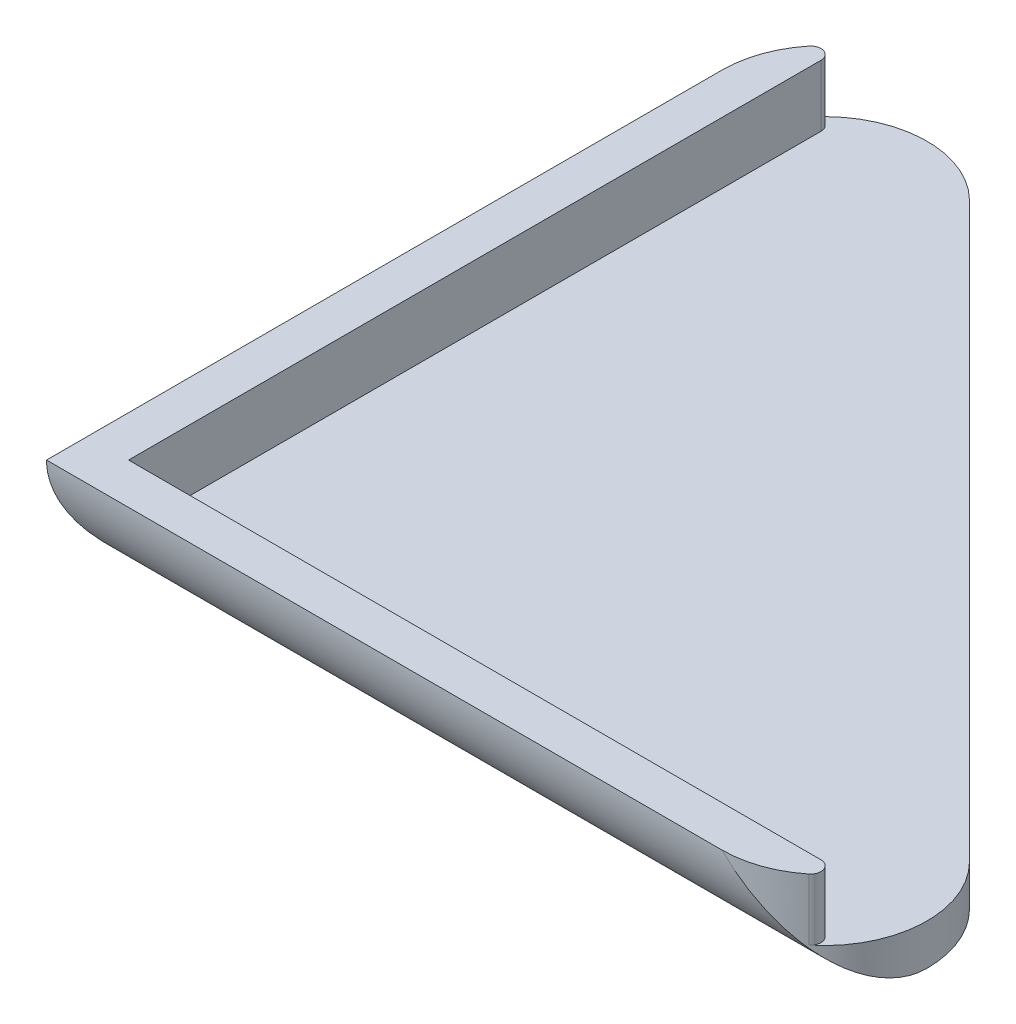
from build123d import *

# Parameters (mm, degrees)
BOSS_EXTRUDE1_DEPTH = 2
BOSS_EXTRUDE2_DEPTH = 3
FILLET1_R           = 5
FILLET2_R           = 0.5


with BuildPart() as part:
    # Sketch1 → Boss-Extrude1 (new body)
    with BuildSketch(Plane(origin=(0, 0, 0), x_dir=(1, 0, 0), z_dir=(0, 1, 0))):
        Polygon((0, 0), (0, 45), (45, 0), align=None)
    extrude(amount=BOSS_EXTRUDE1_DEPTH)

    # Sketch2 → Boss-Extrude2 (add)
    with BuildSketch(Plane(origin=(0, 2, 0), x_dir=(1, 0, 0), z_dir=(0, 1, 0))):
        Polygon((2, 43), (2, 2), (43, 2), (45, 0), (0, 0), (0, 45), align=None)
    extrude(amount=BOSS_EXTRUDE2_DEPTH)

    # Fillet1
    fillet1_edges = [part.edges().sort_by_distance(p)[0] for p in [
        (0, 0, -22.5),
        (22.5, 0, 0),
        (45, 2.5, 0),
        (0, 2.5, -45),
    ]]
    fillet(fillet1_edges, radius=FILLET1_R - 0.0001)  # a hair under: the kernel refuses the full size

    # Fillet2
    fillet2_edges = [part.edges().sort_by_distance(p)[0] for p in [
        (36.929123609, 3.5, -2),
        (2, 3.5, -36.929123609),
    ]]
    fillet(fillet2_edges, radius=FILLET2_R)


solid = part.part
